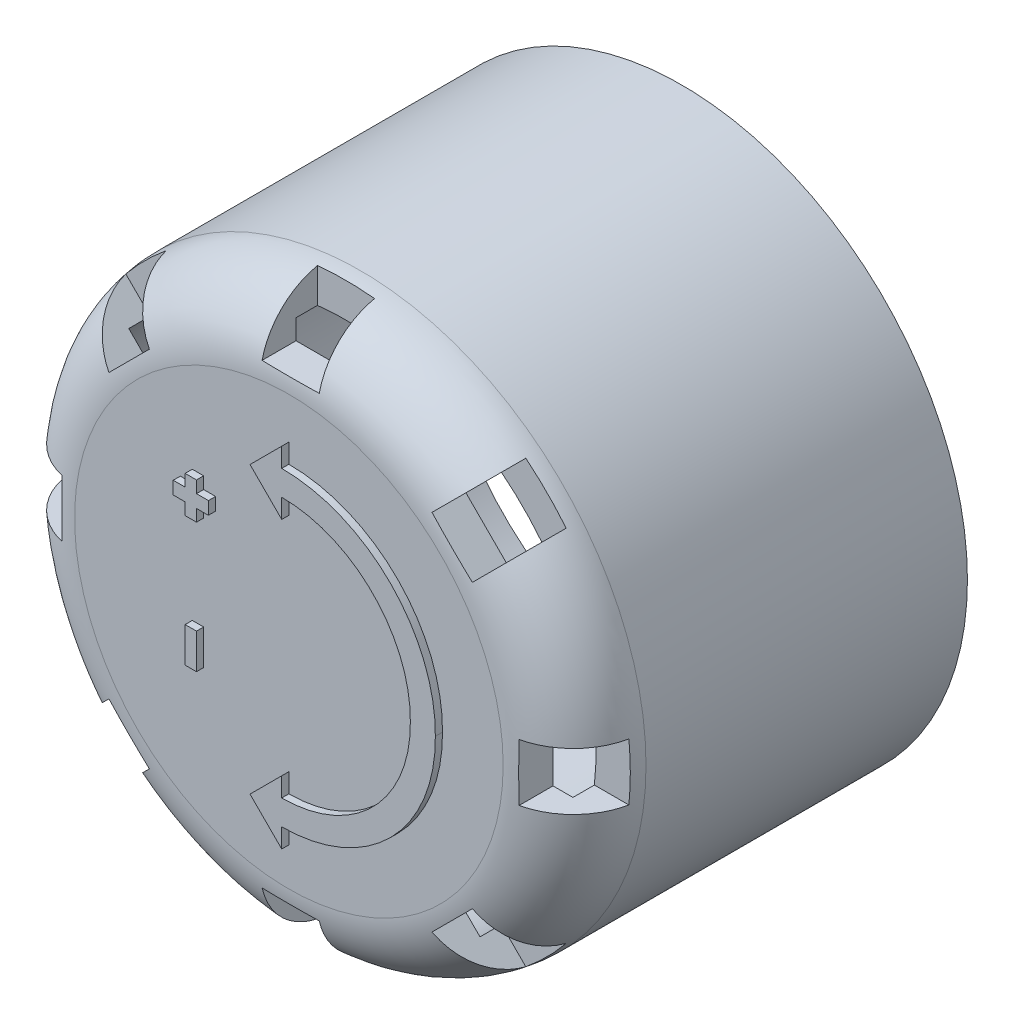
from build123d import *

# Parameters (mm, degrees)
ESQUISSE1_R             = 8
EXTRUSION1_DEPTH        = 11
COQUE1_T                = -1
CONG_1_R                = 2
ESQUISSE2_W             = 1.6
ESQUISSE2_H             = 1.604205815
ESQUISSE2_W_2           = 1.604205815
ESQUISSE2_H_2           = 1.6
ENL_V_MAT_EXTRU_1_DEPTH = 1.6
EXTRUSION2_OUTLINE_W    = 0.31753998
EXTRUSION2_OUTLINE_H    = 0.984981962
EXTRUSION2_DEPTH        = 0.2


# Read off the part's stored shape, not the designer's step: Extrusion2
with BuildPart() as part:
    # Esquisse1 → Extrusion1 (new body)
    with BuildSketch(Plane.XY):
        Circle(ESQUISSE1_R)
    extrude(amount=EXTRUSION1_DEPTH)

    # Coque1
    coque1_openings = [part.faces().sort_by_distance(p)[0] for p in [
        (0, 0, 0),
    ]]
    offset(amount=COQUE1_T, openings=coque1_openings, kind=Kind.INTERSECTION)

    # Congé1
    cong_1_edges = [part.edges().sort_by_distance(p)[0] for p in [
        (-8, 0, 11),
    ]]
    fillet(cong_1_edges, radius=CONG_1_R)

    # Esquisse2 → Enlèv. mat.-Extru.1 (cut)
    with BuildSketch(Plane.XY.offset(11)):
        Polygon((5.091168825, 6.222539674), (6.222539674, 5.091168825), (5.088194864, 3.956824014), (3.956824014, 5.088194864), align=None)
        with Locations((0, 7.197897092)):
            Rectangle(ESQUISSE2_W, ESQUISSE2_H)
        with Locations((7.197897092, 0)):
            Rectangle(ESQUISSE2_W_2, ESQUISSE2_H_2)
        Polygon((6.222539674, -5.091168825), (5.091168825, -6.222539674), (3.956824014, -5.088194864), (5.088194864, -3.956824014), align=None)
        with Locations((0, -7.197897092)):
            Rectangle(ESQUISSE2_W, ESQUISSE2_H)
        Polygon((-5.091168825, -6.222539674), (-6.222539674, -5.091168825), (-5.088194864, -3.956824014), (-3.956824014, -5.088194864), align=None)
        with Locations((-7.197897092, 0)):
            Rectangle(ESQUISSE2_W_2, ESQUISSE2_H_2)
        Polygon((-6.222539674, 5.091168825), (-5.091168825, 6.222539674), (-3.956824014, 5.088194864), (-5.088194864, 3.956824014), align=None)
    extrude(amount=-ENL_V_MAT_EXTRU_1_DEPTH, mode=Mode.SUBTRACT)

    # Extrusion2 outline → Extrusion2 (add)
    with BuildSketch(Plane.XY.offset(11)):
        with BuildLine():
            Line((0, 3.063299939), (0, 3.601368951))
            ThreePointArc((0, 3.601368951), (2.562333988, 2.530672412), (3.601090597, -0.044775365))
            ThreePointArc((3.601090597, -0.044775365), (2.562333988, -2.620223143), (0, -3.690919682))
            Line((0, -3.690919682), (0, -3.152850669))
            Line((0, -3.152850669), (-0.888069013, -4.040919682))
            Line((-0.888069013, -4.040919682), (0, -4.928988695))
            Line((0, -4.928988695), (0, -4.390919682))
            ThreePointArc((0, -4.390919682), (3.057316652, -3.11520599), (4.301135899, -0.044775365))
            ThreePointArc((4.301135899, -0.044775365), (3.057316652, 3.025655259), (0, 4.301368951))
            Line((0, 4.301368951), (0, 4.839437964))
            Line((0, 4.839437964), (-0.888069013, 3.951368951))
            Line((-0.888069013, 3.951368951), (0, 3.063299939))
        make_face()
        with Locations((-2.545565984, -1.329837608)):
            Rectangle(EXTRUSION2_OUTLINE_W, EXTRUSION2_OUTLINE_H)
        Polygon((-2.704335974, 1.803252946), (-2.386795994, 1.803252946), (-2.386795994, 2.136862061), (-2.053186879, 2.136862061), (-2.053186879, 2.494786598), (-2.386795994, 2.494786598), (-2.386795994, 2.828395713), (-2.704335974, 2.828395713), (-2.704335974, 2.494786598), (-3.037945089, 2.494786598), (-3.037945089, 2.136862061), (-2.704335974, 2.136862061), align=None)
    extrude(amount=EXTRUSION2_DEPTH)


solid = part.part
